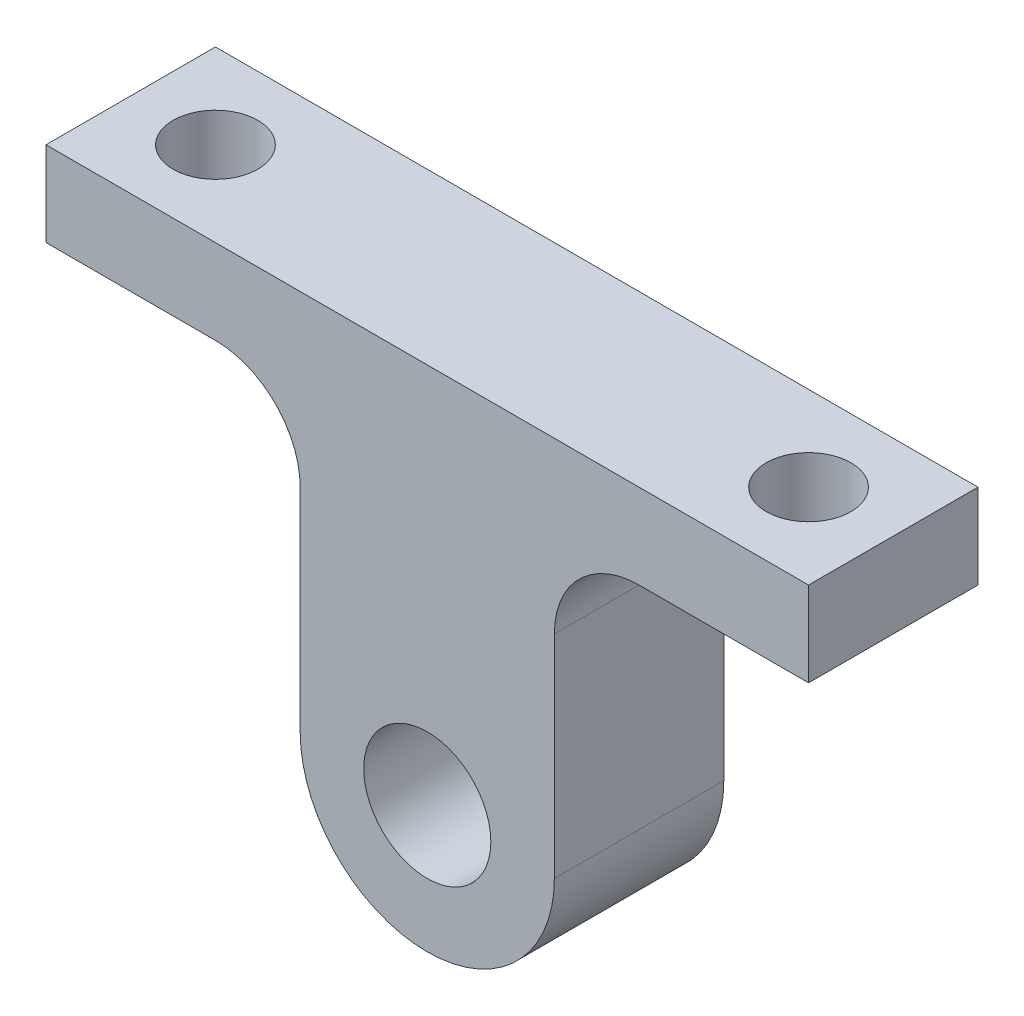
from build123d import *

# Parameters (mm, degrees)
SKETCH1_R           = 4.7625
BOSS_EXTRUDE1_DEPTH = 6.35
FILLET1_R           = 6.35
FILLET2_R           = 9.525
SKETCH3_R           = 3.175
CUT_EXTRUDE2_DEPTH  = 49.046468393


with BuildPart() as part:
    # Sketch1 → Boss-Extrude1 (new, symmetric)
    with BuildSketch(Plane.XY):
        Polygon((-9.525, 22.225), (-9.525, -9.525), (9.525, -9.525), (9.525, 22.225), (28.575, 22.225), (28.575, 28.575), (-28.575, 28.575), (-28.575, 22.225), align=None)
        Circle(SKETCH1_R, mode=Mode.SUBTRACT)
    extrude(amount=BOSS_EXTRUDE1_DEPTH, both=True)

    # Fillet1
    fillet1_edges = [part.edges().sort_by_distance(p)[0] for p in [
        (9.525, 22.225, 0),
        (-9.525, 22.225, 0),
    ]]
    fillet(fillet1_edges, radius=FILLET1_R)

    # Fillet2
    fillet2_edges = [part.edges().sort_by_distance(p)[0] for p in [
        (9.525, -9.525, 0),
        (-9.525, -9.525, 0),
    ]]
    fillet(fillet2_edges, radius=FILLET2_R - 0.0001)  # a hair under: the kernel refuses the full size

    # Sketch3 → Cut-Extrude2 (cut, through all)
    with BuildSketch(Plane(origin=(0, 28.575, 0), x_dir=(1, 0, 0), z_dir=(0, 1, 0))):
        with Locations(Location((-22.225, 0, 0), (0, 0, 180))):
            Circle(SKETCH3_R)
        with Locations(Location((22.225, 0, 0), (0, 0, 180))):
            Circle(SKETCH3_R)
    extrude(amount=-CUT_EXTRUDE2_DEPTH, mode=Mode.SUBTRACT)


solid = part.part
